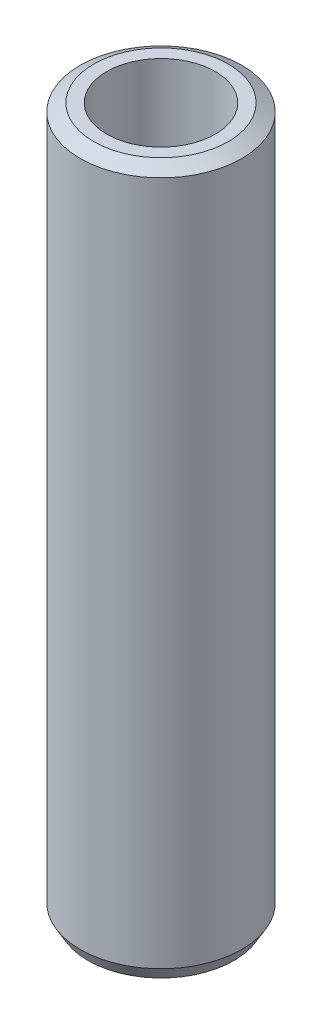
from build123d import *
from OCP.BRepFilletAPI import BRepFilletAPI_MakeChamfer

# Parameters (mm, degrees)
SKETCH1_R           = 12.5
BOSS_EXTRUDE1_DEPTH = 109.249292653
SKETCH2_R           = 8.395558689
CUT_EXTRUDE1_DEPTH  = 111.670266762
CHAMFER1_SIZE       = 1.210466994
CHAMFER1_SIZE2      = 2.096590334


with BuildPart() as part:
    # Sketch1 → Boss-Extrude1 (new body)
    with BuildSketch(Plane(origin=(0, 0, 0), x_dir=(1, 0, 0), z_dir=(0, 1, 0))):
        Circle(SKETCH1_R)
    extrude(amount=BOSS_EXTRUDE1_DEPTH)

    # Sketch2 → Cut-Extrude1 (cut, through all)
    with BuildSketch(Plane(origin=(0, 0, 0), x_dir=(1, 0, 0), z_dir=(0, 1, 0))):
        Circle(SKETCH2_R)
    extrude(amount=CUT_EXTRUDE1_DEPTH, mode=Mode.SUBTRACT)

    # Chamfer1: one chamfer whose edges measure the first distance from different faces: ONE call of the kernel's chamfer builder (chamfer() names one face for all edges)
    chamfer1_edges_1 = [part.edges().sort_by_distance(p)[0] for p in [
        (-12.5, 109.249292653, 0),
    ]]
    chamfer1_side_1 = [part.faces().sort_by_distance(p)[0] for p in [
        (-12.5, 54.624646327, 0),
    ]]
    chamfer1_edges_2 = [part.edges().sort_by_distance(p)[0] for p in [
        (-12.5, 0, 0),
    ]]
    chamfer1_side_2 = [part.faces().sort_by_distance(p)[0] for p in [
        (-12.146446609, 0, 0),
    ]]
    chamfer1 = BRepFilletAPI_MakeChamfer(part.part.solid().wrapped)
    for e in chamfer1_edges_1:
        chamfer1.Add(CHAMFER1_SIZE, CHAMFER1_SIZE2, e.wrapped, chamfer1_side_1[0].wrapped)  # the first distance lies on this face
    for e in chamfer1_edges_2:
        chamfer1.Add(CHAMFER1_SIZE, CHAMFER1_SIZE2, e.wrapped, chamfer1_side_2[0].wrapped)  # the first distance lies on this face
    add(Compound.cast(chamfer1.Shape()), mode=Mode.REPLACE)


solid = part.part
